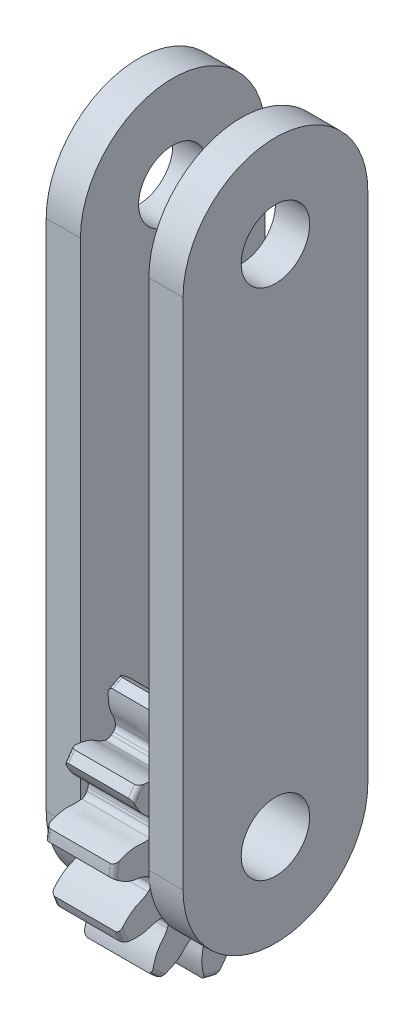
from build123d import *

# Parameters (mm, degrees)
SKETCH1_W                = 9
SKETCH1_H                = 7.5
CUT_EXTRUDE1_DEPTH       = 14.910427743
CUT_EXTRUDE2_DEPTH       = 14.910427916
CUT_EXTRUDE3_DEPTH       = 14.910427916
CUT_EXTRUDE4_DEPTH       = 14.910427916
CUT_EXTRUDE5_DEPTH       = 14.910427916
CUT_EXTRUDE6_DEPTH       = 14.910427916
CUT_EXTRUDE7_DEPTH       = 14.910427916
CUT_EXTRUDE8_DEPTH       = 14.910427916
CUT_EXTRUDE9_DEPTH       = 14.910427916
CUT_EXTRUDE10_DEPTH      = 14.910427916
CUT_EXTRUDE11_DEPTH      = 14.897973662
CUT_EXTRUDE12_DEPTH      = 14.897973662
CUT_EXTRUDE13_DEPTH      = 14.897973662
FILLET2_R                = 0.39
SKETCH15_W               = 7.292048081
SKETCH15_H               = 20.876726486
SKETCH15_W_2             = 7.106970719
CUT_EXTRUDE14_DEPTH      = 10
CUT_EXTRUDE15_DEPTH      = 10
CUT_EXTRUDE15_DEPTH_BACK = 11.881345073
SKETCH18_W               = 4.393422378
SKETCH18_H               = 18.360571133
FILLET4_R                = 0.25
SKETCH19_R               = 2
BOSS_EXTRUDE1_DEPTH      = 2
BOSS_EXTRUDE2_START      = -6
SKETCH19_2_R             = 2
BOSS_EXTRUDE2_DEPTH      = 2
SKETCH20_R               = 2
CUT_EXTRUDE16_DEPTH      = 5


with BuildPart() as part:
    # Sketch1 → Revolve1 (revolve)
    with BuildSketch(Plane.XY):
        with Locations((0, 3.75)):
            Rectangle(SKETCH1_W, SKETCH1_H)
    revolve(axis=Axis((-4.5, 0, 0), (1, 0, 0)))

    # Sketch2 → Cut-Extrude1 (cut, through all)
    with BuildSketch(Plane.ZY.offset(4.5)):
        with BuildLine():
            ThreePointArc((3.201594162, 6.782314857), (1.794867482, 7.282063631), (0.317028032, 7.493296553))
            add(Edge.make_bspline(
                [(0.317028032, 7.493296553), (0.371871945, 7.408970163), (0.423858847, 7.32269625), (0.47240366, 7.234592924), (0.55951672, 7.076492607), (0.636261204, 6.911885842), (0.697729626, 6.742162454), (0.77567653, 6.526939544), (0.83047634, 6.296563636), (0.826790854, 6.067690226), (0.823538507, 5.865715366), (0.858399887, 5.661440277), (0.918999535, 5.468743353), (0.941929817, 5.395828826), (0.966010575, 5.323281093), (0.989559235, 5.250563924)],
                knots=[-0.0003014, -0.0003014, -0.0003014, -0.0003014, 0, 0, 0, 0.000541534, 0.000541534, 0.000541534, 0.001234633, 0.001234633, 0.001234633, 0.001842085, 0.001842085, 0.001842085, 0.002069299, 0.002069299, 0.002069299, 0.002069299], degree=3))
            ThreePointArc((0.989559235, 5.250563924), (1.278663577, 5.187742135), (1.5638475, 5.109014582))
            add(Edge.make_bspline(
                [(1.5638475, 5.109014582), (1.618492169, 5.162458825), (1.673529252, 5.215505756), (1.727718082, 5.269412134), (1.888913184, 5.429767028), (2.014491806, 5.625477563), (2.123183008, 5.825186791), (2.250960235, 6.059964682), (2.453612602, 6.251567917), (2.66167207, 6.419374161), (2.752319565, 6.492484104), (2.846626475, 6.561254078), (2.943790305, 6.625450825), (3.027718259, 6.680902547), (3.113843861, 6.733134785), (3.201594162, 6.782314857)],
                knots=[-0.000226024, -0.000226024, -0.000226024, -0.000226024, 0, 0, 0, 0.000682113, 0.000682113, 0.000682113, 0.001501297, 0.001501297, 0.001501297, 0.001854279, 0.001854279, 0.001854279, 0.002159306, 0.002159306, 0.002159306, 0.002159306], degree=3))
        make_face()
    extrude(amount=-CUT_EXTRUDE1_DEPTH, mode=Mode.SUBTRACT)

    # Sketch3 → Cut-Extrude2 (cut, through all)
    with BuildSketch(Plane.ZY.offset(4.5)):
        with BuildLine():
            ThreePointArc((5.986769716, 4.517586564), (4.973419937, 5.613830611), (3.763022925, 6.487654312))
            add(Edge.make_bspline(
                [(3.763022925, 6.487654312), (3.77239637, 6.387499765), (3.778335, 6.28694849), (3.78037564, 6.186376971), (3.784037542, 6.005902635), (3.77549483, 5.824485643), (3.751048024, 5.645637246), (3.720047506, 5.418843091), (3.661509306, 5.189388614), (3.551883192, 4.988444004), (3.455140985, 4.811115588), (3.391077837, 4.614038089), (3.355185434, 4.415251375), (3.34160412, 4.340032535), (3.329211959, 4.264603822), (3.316269909, 4.189272358)],
                knots=[-0.0003014, -0.0003014, -0.0003014, -0.0003014, 0, 0, 0, 0.000541534, 0.000541534, 0.000541534, 0.001234633, 0.001234633, 0.001234633, 0.001842085, 0.001842085, 0.001842085, 0.002069299, 0.002069299, 0.002069299, 0.002069299], degree=3))
            ThreePointArc((3.316269909, 4.189272358), (3.543064349, 3.99929294), (3.758995654, 3.797051576))
            add(Edge.make_bspline(
                [(3.758995654, 3.797051576), (3.832217884, 3.818979459), (3.905602939, 3.840373176), (3.978636308, 3.862922098), (4.195888117, 3.929998207), (4.398033686, 4.044931983), (4.587084472, 4.171254402), (4.809332313, 4.319758862), (5.077814535, 4.39523785), (5.340025495, 4.447132845), (5.454265751, 4.469742492), (5.569729373, 4.486808674), (5.685597388, 4.498497788), (5.7856816, 4.508594583), (5.886215565, 4.51481937), (5.986769716, 4.517586564)],
                knots=[-0.000226024, -0.000226024, -0.000226024, -0.000226024, 0, 0, 0, 0.000682113, 0.000682113, 0.000682113, 0.001501297, 0.001501297, 0.001501297, 0.001854279, 0.001854279, 0.001854279, 0.002159306, 0.002159306, 0.002159306, 0.002159306], degree=3))
        make_face()
    extrude(amount=-CUT_EXTRUDE2_DEPTH, mode=Mode.SUBTRACT)

    # Sketch4 → Cut-Extrude3 (cut, through all)
    with BuildSketch(Plane.ZY.offset(4.5)):
        with BuildLine():
            ThreePointArc((7.400448478, 1.217933632), (7.01262182, 2.659536653), (6.346954614, 3.995768653))
            add(Edge.make_bspline(
                [(6.346954614, 3.995768653), (6.308710249, 3.902730148), (6.267240137, 3.810936598), (6.222309119, 3.720936607), (6.141680967, 3.559432748), (6.049808091, 3.402765975), (5.945046524, 3.255764582), (5.81220043, 3.06935499), (5.653734615, 2.893387198), (5.463281896, 2.766405379), (5.295212301, 2.654347209), (5.14690072, 2.50961538), (5.022738785, 2.350278517), (4.97575719, 2.289987093), (4.929731005, 2.228957209), (4.883263112, 2.168268981)],
                knots=[-0.0003014, -0.0003014, -0.0003014, -0.0003014, 0, 0, 0, 0.000541534, 0.000541534, 0.000541534, 0.001234633, 0.001234633, 0.001234633, 0.001842085, 0.001842085, 0.001842085, 0.002069299, 0.002069299, 0.002069299, 0.002069299], degree=3))
            ThreePointArc((4.883263112, 2.168268981), (4.995791778, 1.894653928), (5.093003205, 1.615229813))
            add(Edge.make_bspline(
                [(5.093003205, 1.615229813), (5.168028665, 1.600617923), (5.24295006, 1.585457383), (5.318096903, 1.571483163), (5.541635649, 1.529914158), (5.77403905, 1.537741233), (6.000140163, 1.561737899), (6.265944317, 1.589948346), (6.538750353, 1.532011761), (6.795043434, 1.456106987), (6.906705384, 1.423036742), (7.016874394, 1.384489475), (7.124902628, 1.34099312), (7.218215011, 1.303421936), (7.310126219, 1.262213248), (7.400448478, 1.217933632)],
                knots=[-0.000226024, -0.000226024, -0.000226024, -0.000226024, 0, 0, 0, 0.000682113, 0.000682113, 0.000682113, 0.001501297, 0.001501297, 0.001501297, 0.001854279, 0.001854279, 0.001854279, 0.002159306, 0.002159306, 0.002159306, 0.002159306], degree=3))
        make_face()
    extrude(amount=-CUT_EXTRUDE3_DEPTH, mode=Mode.SUBTRACT)

    # Sketch5 → Cut-Extrude4 (cut, through all)
    with BuildSketch(Plane.ZY.offset(4.5)):
        with BuildLine():
            ThreePointArc((7.118773678, -2.360733218), (7.445316556, -0.904025102), (7.476875491, 0.58850055))
            add(Edge.make_bspline(
                [(7.476875491, 0.58850055), (7.399774639, 0.523892088), (7.320396088, 0.461885057), (7.238786565, 0.403074509), (7.092339297, 0.297539714), (6.938183226, 0.20151363), (6.777106511, 0.120035489), (6.57284828, 0.01671465), (6.350757459, -0.065454355), (6.123108558, -0.089383381), (5.922214294, -0.110500127), (5.723630676, -0.169729969), (5.53964321, -0.253114825), (5.470024252, -0.284666794), (5.400908088, -0.317316639), (5.331559587, -0.349458689)],
                knots=[-0.0003014, -0.0003014, -0.0003014, -0.0003014, 0, 0, 0, 0.000541534, 0.000541534, 0.000541534, 0.001234633, 0.001234633, 0.001234633, 0.001842085, 0.001842085, 0.001842085, 0.002069299, 0.002069299, 0.002069299, 0.002069299], degree=3))
            ThreePointArc((5.331559587, -0.349458689), (5.304043517, -0.644027465), (5.260265099, -0.936621634))
            add(Edge.make_bspline(
                [(5.260265099, -0.936621634), (5.31990636, -0.98442589), (5.379200507, -1.03266759), (5.439245589, -1.079963626), (5.617861238, -1.220654788), (5.827281653, -1.321727502), (6.038636052, -1.405553936), (6.287103991, -1.504100175), (6.501737266, -1.68217976), (6.693398811, -1.868495433), (6.776902048, -1.949669576), (6.856538054, -2.034999578), (6.93197854, -2.123716912), (6.997142353, -2.20034897), (7.059375053, -2.279550719), (7.118773678, -2.360733218)],
                knots=[-0.000226024, -0.000226024, -0.000226024, -0.000226024, 0, 0, 0, 0.000682113, 0.000682113, 0.000682113, 0.001501297, 0.001501297, 0.001501297, 0.001854279, 0.001854279, 0.001854279, 0.002159348, 0.002159348, 0.002159348, 0.002159348], degree=3))
        make_face()
    extrude(amount=-CUT_EXTRUDE4_DEPTH, mode=Mode.SUBTRACT)

    # Sketch6 → Cut-Extrude5 (cut, through all)
    with BuildSketch(Plane.ZY.offset(4.5)):
        with BuildLine():
            ThreePointArc((5.206273619, -5.398584537), (6.172378994, -4.2604856), (6.893934298, -2.953585937))
            add(Edge.make_bspline(
                [(6.893934298, -2.953585937), (6.795639835, -2.974963337), (6.696537515, -2.992978783), (6.596945247, -3.007127102), (6.418228166, -3.032516083), (6.237104198, -3.045903059), (6.05661307, -3.043192289), (5.827735801, -3.039754814), (5.592898304, -3.009301104), (5.38020484, -2.924695485), (5.192508363, -2.850033215), (4.989145821, -2.810192227), (4.787482136, -2.798522612), (4.711174679, -2.79410695), (4.634802216, -2.790897068), (4.558460012, -2.787129585)],
                knots=[-0.000301441, -0.000301441, -0.000301441, -0.000301441, 0, 0, 0, 0.000541534, 0.000541534, 0.000541534, 0.001234633, 0.001234633, 0.001234633, 0.001842085, 0.001842085, 0.001842085, 0.002069299, 0.002069299, 0.002069299, 0.002069299], degree=3))
            ThreePointArc((4.558460012, -2.787129585), (4.397202806, -3.035169927), (4.222463652, -3.273904352))
            add(Edge.make_bspline(
                [(4.222463652, -3.273904352), (4.253057621, -3.343949595), (4.283140944, -3.414220862), (4.314328659, -3.484003764), (4.407102519, -3.691586432), (4.545564255, -3.878404395), (4.693753195, -4.050850303), (4.867963908, -4.253577473), (4.975254525, -4.511004171), (5.058377185, -4.765048067), (5.094592124, -4.875730091), (5.125451476, -4.988294752), (5.151021708, -5.101908992), (5.173108706, -5.200046443), (5.191406137, -5.299097087), (5.206273619, -5.398584537)],
                knots=[-0.000226024, -0.000226024, -0.000226024, -0.000226024, 0, 0, 0, 0.000682113, 0.000682113, 0.000682113, 0.001501297, 0.001501297, 0.001501297, 0.001854279, 0.001854279, 0.001854279, 0.002159306, 0.002159306, 0.002159306, 0.002159306], degree=3))
        make_face()
    extrude(amount=-CUT_EXTRUDE5_DEPTH, mode=Mode.SUBTRACT)

    # Sketch7 → Cut-Extrude6 (cut, through all)
    with BuildSketch(Plane.ZY.offset(4.5)):
        with BuildLine():
            ThreePointArc((2.741072183, -4.586302681), (2.483015924, -4.730991537), (2.217346668, -4.861175038))
            add(Edge.make_bspline(
                [(2.217346668, -4.861175038), (2.211884635, -4.937414746), (2.205865408, -5.013617281), (2.201051028, -5.089900626), (2.186729725, -5.316820112), (2.222512867, -5.546585581), (2.273588047, -5.768145684), (2.333631959, -6.028611433), (2.309000931, -6.306411889), (2.264542306, -6.569985614), (2.245172541, -6.684819601), (2.220185733, -6.798831714), (2.19002788, -6.911315207), (2.163978197, -7.008475944), (2.134148639, -7.104684174), (2.101079016, -7.199685199)],
                knots=[-0.000226024, -0.000226024, -0.000226024, -0.000226024, 0, 0, 0, 0.000682113, 0.000682113, 0.000682113, 0.001501297, 0.001501297, 0.001501297, 0.001854279, 0.001854279, 0.001854279, 0.002159306, 0.002159306, 0.002159306, 0.002159306], degree=3))
            ThreePointArc((2.101079016, -7.199685199), (3.48542379, -6.640920192), (4.731675839, -5.81904148))
            add(Edge.make_bspline(
                [(4.731675839, -5.81904148), (4.634705841, -5.792290513), (4.5385829, -5.762187254), (4.443823274, -5.728432133), (4.27377831, -5.66785899), (4.107179763, -5.595540064), (3.948622564, -5.509261387), (3.747559281, -5.399853084), (3.55377355, -5.263753237), (3.404761032, -5.0899951), (3.273261342, -4.936658041), (3.111707784, -4.806873313), (2.9385666, -4.702822594), (2.873051763, -4.663450876), (2.806919011, -4.625116614), (2.741072183, -4.586302681)],
                knots=[-0.0003014, -0.0003014, -0.0003014, -0.0003014, 0, 0, 0, 0.000541534, 0.000541534, 0.000541534, 0.001234633, 0.001234633, 0.001234633, 0.001842085, 0.001842085, 0.001842085, 0.002069299, 0.002069299, 0.002069299, 0.002069299], degree=3))
        make_face()
    extrude(amount=-CUT_EXTRUDE6_DEPTH, mode=Mode.SUBTRACT)

    # Sketch8 → Cut-Extrude7 (cut, through all)
    with BuildSketch(Plane.ZY.offset(4.5)):
        with BuildLine():
            ThreePointArc((-1.485447468, -7.351424748), (0, -7.5), (1.485447468, -7.351424748))
            add(Edge.make_bspline(
                [(1.485447468, -7.351424748), (1.412016594, -7.282673737), (1.340893638, -7.211348067), (1.272674943, -7.137422398), (1.150257348, -7.004763709), (1.036349942, -6.863306274), (0.936050215, -6.713225095), (0.808862093, -6.522910087), (0.700522102, -6.312342938), (0.649327503, -6.089238178), (0.604149594, -5.892354003), (0.521414994, -5.702357651), (0.416460869, -5.529762594), (0.376747312, -5.464454407), (0.336004488, -5.399777681), (0.295737752, -5.334809105)],
                knots=[-0.0003014, -0.0003014, -0.0003014, -0.0003014, 0, 0, 0, 0.000541534, 0.000541534, 0.000541534, 0.001234633, 0.001234633, 0.001234633, 0.001842085, 0.001842085, 0.001842085, 0.002069299, 0.002069299, 0.002069299, 0.002069299], degree=3))
            ThreePointArc((0.295737752, -5.334809105), (1.8e-08, -5.343), (-0.295737715, -5.334809107))
            add(Edge.make_bspline(
                [(-0.295737715, -5.334809107), (-0.336004465, -5.399777682), (-0.376747309, -5.464454402), (-0.416460869, -5.529762594), (-0.534596496, -5.72403438), (-0.609689435, -5.944110854), (-0.667428722, -6.164028402), (-0.735306948, -6.422563166), (-0.88621695, -6.657096644), (-1.048071925, -6.869818634), (-1.118589015, -6.962497501), (-1.193697805, -7.051838265), (-1.272674943, -7.137422398), (-1.340893638, -7.211348067), (-1.412016594, -7.282673737), (-1.485447468, -7.351424748)],
                knots=[-0.000226024, -0.000226024, -0.000226024, -0.000226024, 0, 0, 0, 0.000682113, 0.000682113, 0.000682113, 0.001501297, 0.001501297, 0.001501297, 0.001854279, 0.001854279, 0.001854279, 0.002159306, 0.002159306, 0.002159306, 0.002159306], degree=3))
        make_face()
    extrude(amount=-CUT_EXTRUDE7_DEPTH, mode=Mode.SUBTRACT)

    # Sketch9 → Cut-Extrude8 (cut, through all)
    with BuildSketch(Plane.ZY.offset(4.5)):
        with BuildLine():
            ThreePointArc((-4.731675839, -5.81904148), (-3.48542379, -6.640920192), (-2.101079016, -7.199685199))
            add(Edge.make_bspline(
                [(-2.101079016, -7.199685199), (-2.134148639, -7.104684174), (-2.163978197, -7.008475944), (-2.19002788, -6.911315207), (-2.23677371, -6.736961478), (-2.271895162, -6.558771729), (-2.290959958, -6.379269837), (-2.315135652, -6.151646999), (-2.313210517, -5.914850944), (-2.254859131, -5.693510173), (-2.203365544, -5.498182673), (-2.188327687, -5.291500573), (-2.201051028, -5.089900626), (-2.205865408, -5.013617287), (-2.211884614, -4.937414757), (-2.217346635, -4.861175053)],
                knots=[-0.0003014, -0.0003014, -0.0003014, -0.0003014, 0, 0, 0, 0.000541534, 0.000541534, 0.000541534, 0.001234633, 0.001234633, 0.001234633, 0.001842085, 0.001842085, 0.001842085, 0.002069299, 0.002069299, 0.002069299, 0.002069299], degree=3))
            ThreePointArc((-2.217346635, -4.861175053), (-2.483015892, -4.730991554), (-2.741072152, -4.5863027))
            add(Edge.make_bspline(
                [(-2.741072152, -4.5863027), (-2.806918991, -4.625116625), (-2.873051758, -4.663450873), (-2.9385666, -4.702822594), (-3.133453103, -4.819941353), (-3.302219236, -4.979911964), (-3.455545616, -5.147806498), (-3.635795895, -5.345183078), (-3.878413208, -5.482720785), (-4.120585508, -5.595858995), (-4.226095307, -5.64515113), (-4.334119561, -5.689353654), (-4.443823274, -5.728432133), (-4.5385829, -5.762187254), (-4.634705841, -5.792290513), (-4.731675839, -5.81904148)],
                knots=[-0.000226024, -0.000226024, -0.000226024, -0.000226024, 0, 0, 0, 0.000682113, 0.000682113, 0.000682113, 0.001501297, 0.001501297, 0.001501297, 0.001854279, 0.001854279, 0.001854279, 0.002159306, 0.002159306, 0.002159306, 0.002159306], degree=3))
        make_face()
    extrude(amount=-CUT_EXTRUDE8_DEPTH, mode=Mode.SUBTRACT)

    # Sketch10 → Cut-Extrude9 (cut, through all)
    with BuildSketch(Plane.ZY.offset(4.5)):
        with BuildLine():
            ThreePointArc((-6.893934298, -2.953585937), (-6.172378994, -4.2604856), (-5.206273619, -5.398584537))
            add(Edge.make_bspline(
                [(-5.206273619, -5.398584537), (-5.191406137, -5.299097087), (-5.173108706, -5.200046443), (-5.151021708, -5.101908992), (-5.111386867, -4.925802561), (-5.059676463, -4.751701622), (-4.993138813, -4.583900738), (-4.90876372, -4.371115719), (-4.797014483, -4.16233788), (-4.642484713, -3.993467602), (-4.50611619, -3.844443953), (-4.396750868, -3.668424483), (-4.314328659, -3.484003764), (-4.283140946, -3.414220868), (-4.253057607, -3.343949614), (-4.22246363, -3.273904381)],
                knots=[-0.0003014, -0.0003014, -0.0003014, -0.0003014, 0, 0, 0, 0.000541534, 0.000541534, 0.000541534, 0.001234633, 0.001234633, 0.001234633, 0.001842085, 0.001842085, 0.001842085, 0.002069299, 0.002069299, 0.002069299, 0.002069299], degree=3))
            ThreePointArc((-4.22246363, -3.273904381), (-4.397202785, -3.035169957), (-4.558459993, -2.787129616))
            add(Edge.make_bspline(
                [(-4.558459993, -2.787129616), (-4.634802203, -2.790897088), (-4.711174673, -2.794106949), (-4.787482136, -2.798522612), (-5.014473366, -2.811657849), (-5.238250405, -2.874875258), (-5.452038652, -2.952284163), (-5.703367818, -3.043285963), (-5.982111739, -3.052319668), (-6.24912261, -3.039955498), (-6.365454095, -3.034568668), (-6.481646758, -3.023506684), (-6.596945247, -3.007127102), (-6.696537515, -2.992978783), (-6.795639835, -2.974963337), (-6.893934298, -2.953585937)],
                knots=[-0.000226024, -0.000226024, -0.000226024, -0.000226024, 0, 0, 0, 0.000682113, 0.000682113, 0.000682113, 0.001501297, 0.001501297, 0.001501297, 0.001854279, 0.001854279, 0.001854279, 0.002159348, 0.002159348, 0.002159348, 0.002159348], degree=3))
        make_face()
    extrude(amount=-CUT_EXTRUDE9_DEPTH, mode=Mode.SUBTRACT)

    # Sketch11 → Cut-Extrude10 (cut, through all)
    with BuildSketch(Plane.ZY.offset(4.5)):
        with BuildLine():
            ThreePointArc((-7.476875491, 0.58850055), (-7.445316556, -0.904025102), (-7.118773678, -2.360733218))
            add(Edge.make_bspline(
                [(-7.118773678, -2.360733218), (-7.059375053, -2.279550719), (-6.997142353, -2.20034897), (-6.93197854, -2.123716912), (-6.815042892, -1.986201641), (-6.688346863, -1.856073938), (-6.55144974, -1.738415222), (-6.377853177, -1.589214505), (-6.181880242, -1.45628337), (-5.966572994, -1.37856973), (-5.776569921, -1.309989454), (-5.597931411, -1.204956553), (-5.439245589, -1.079963626), (-5.379200511, -1.032667593), (-5.319906357, -0.984425913), (-5.260265093, -0.93662167)],
                knots=[-0.0003014, -0.0003014, -0.0003014, -0.0003014, 0, 0, 0, 0.000541534, 0.000541534, 0.000541534, 0.001234633, 0.001234633, 0.001234633, 0.001842085, 0.001842085, 0.001842085, 0.002069299, 0.002069299, 0.002069299, 0.002069299], degree=3))
            ThreePointArc((-5.260265093, -0.93662167), (-5.304043512, -0.644027501), (-5.331559584, -0.349458725))
            add(Edge.make_bspline(
                [(-5.331559584, -0.349458725), (-5.400908086, -0.317316662), (-5.470024247, -0.284666796), (-5.53964321, -0.253114825), (-5.746738212, -0.159257416), (-5.974261534, -0.111239276), (-6.199535337, -0.080429105), (-6.464366908, -0.04420871), (-6.715380564, 0.077331101), (-6.946061032, 0.212365169), (-7.046564061, 0.271196906), (-7.144306795, 0.334989229), (-7.238786565, 0.403074509), (-7.320396088, 0.461885057), (-7.399774639, 0.523892088), (-7.476875491, 0.58850055)],
                knots=[-0.000226024, -0.000226024, -0.000226024, -0.000226024, 0, 0, 0, 0.000682113, 0.000682113, 0.000682113, 0.001501297, 0.001501297, 0.001501297, 0.001854279, 0.001854279, 0.001854279, 0.002159306, 0.002159306, 0.002159306, 0.002159306], degree=3))
        make_face()
    extrude(amount=-CUT_EXTRUDE10_DEPTH, mode=Mode.SUBTRACT)

    # Sketch12 → Cut-Extrude11 (cut, through all)
    with BuildSketch(Plane.ZY.offset(4.5)):
        with BuildLine():
            ThreePointArc((-6.346954614, 3.995768653), (-7.01262182, 2.659536653), (-7.400448478, 1.217933632))
            add(Edge.make_bspline(
                [(-7.400448478, 1.217933632), (-7.310126219, 1.262213248), (-7.218215011, 1.303421936), (-7.124902628, 1.340993119), (-6.957454721, 1.40841414), (-6.784797599, 1.464757917), (-6.608902486, 1.505320271), (-6.385853332, 1.556756599), (-6.150551737, 1.58338811), (-5.923791308, 1.552141854), (-5.723681099, 1.524567842), (-5.516693331, 1.534552402), (-5.318096903, 1.571483163), (-5.242950066, 1.585457382), (-5.168028672, 1.600617901), (-5.093003216, 1.615229779)],
                knots=[-0.0003014, -0.0003014, -0.0003014, -0.0003014, 0, 0, 0, 0.000541534, 0.000541534, 0.000541534, 0.001234633, 0.001234633, 0.001234633, 0.001842085, 0.001842085, 0.001842085, 0.002069299, 0.002069299, 0.002069299, 0.002069299], degree=3))
            ThreePointArc((-5.093003216, 1.615229779), (-4.995791791, 1.894653894), (-4.883263127, 2.168268948))
            add(Edge.make_bspline(
                [(-4.883263127, 2.168268948), (-4.929731014, 2.228957187), (-4.975757186, 2.289987089), (-5.022738785, 2.350278517), (-5.162494589, 2.529626972), (-5.341641343, 2.677880283), (-5.526793189, 2.809851291), (-5.744457443, 2.964996226), (-5.91023663, 3.189266247), (-6.051740581, 3.416035534), (-6.113391122, 3.514834537), (-6.170292244, 3.616743148), (-6.222309119, 3.720936607), (-6.267240137, 3.810936598), (-6.308710249, 3.902730148), (-6.346954614, 3.995768653)],
                knots=[-0.000226024, -0.000226024, -0.000226024, -0.000226024, 0, 0, 0, 0.000682113, 0.000682113, 0.000682113, 0.001501297, 0.001501297, 0.001501297, 0.001854279, 0.001854279, 0.001854279, 0.002159306, 0.002159306, 0.002159306, 0.002159306], degree=3))
        make_face()
    extrude(amount=-CUT_EXTRUDE11_DEPTH, mode=Mode.SUBTRACT)

    # Sketch13 → Cut-Extrude12 (cut, through all)
    with BuildSketch(Plane.ZY.offset(4.5)):
        with BuildLine():
            ThreePointArc((-3.763022925, 6.487654312), (-4.973419937, 5.613830611), (-5.986769716, 4.517586564))
            add(Edge.make_bspline(
                [(-5.986769716, 4.517586564), (-5.886215565, 4.51481937), (-5.7856816, 4.508594583), (-5.685597388, 4.498497788), (-5.505997519, 4.480379214), (-5.326932971, 4.450031386), (-5.152335318, 4.404205032), (-4.930931447, 4.346093528), (-4.710205951, 4.260324456), (-4.523940423, 4.127276445), (-4.359565915, 4.009865018), (-4.171647291, 3.922513895), (-3.978636308, 3.862922098), (-3.905602944, 3.840373177), (-3.832217901, 3.818979443), (-3.75899568, 3.79705155)],
                knots=[-0.0003014, -0.0003014, -0.0003014, -0.0003014, 0, 0, 0, 0.000541534, 0.000541534, 0.000541534, 0.001234633, 0.001234633, 0.001234633, 0.001842085, 0.001842085, 0.001842085, 0.002069299, 0.002069299, 0.002069299, 0.002069299], degree=3))
            ThreePointArc((-3.75899568, 3.79705155), (-3.543064377, 3.999292915), (-3.316269938, 4.189272336))
            add(Edge.make_bspline(
                [(-3.316269938, 4.189272336), (-3.329211977, 4.264603807), (-3.341604119, 4.340032529), (-3.355185434, 4.415251375), (-3.395585671, 4.639004306), (-3.485315495, 4.853529742), (-3.587929327, 5.056428619), (-3.708562005, 5.294956259), (-3.751128711, 5.57057893), (-3.771039294, 5.837133327), (-3.77971395, 5.953265934), (-3.782738099, 6.069944797), (-3.78037564, 6.186376971), (-3.778335, 6.28694849), (-3.77239637, 6.387499765), (-3.763022925, 6.487654312)],
                knots=[-0.000226024, -0.000226024, -0.000226024, -0.000226024, 0, 0, 0, 0.000682113, 0.000682113, 0.000682113, 0.001501297, 0.001501297, 0.001501297, 0.001854279, 0.001854279, 0.001854279, 0.002159306, 0.002159306, 0.002159306, 0.002159306], degree=3))
        make_face()
    extrude(amount=-CUT_EXTRUDE12_DEPTH, mode=Mode.SUBTRACT)

    # Sketch14 → Cut-Extrude13 (cut, through all)
    with BuildSketch(Plane.ZY.offset(4.5)):
        with BuildLine():
            ThreePointArc((-0.317028032, 7.493296553), (-1.794867482, 7.282063631), (-3.201594162, 6.782314857))
            add(Edge.make_bspline(
                [(-3.201594162, 6.782314857), (-3.113843861, 6.733134785), (-3.027718259, 6.680902547), (-2.943790305, 6.625450825), (-2.79318264, 6.525943404), (-2.648732196, 6.415856293), (-2.51543022, 6.294139496), (-2.346392591, 6.139792806), (-2.190808746, 5.961271812), (-2.087709306, 5.756901741), (-1.996726718, 5.576550443), (-1.870927131, 5.411874726), (-1.727718082, 5.269412134), (-1.673529256, 5.21550576), (-1.618492191, 5.162458818), (-1.563847535, 5.109014571)],
                knots=[-0.0003014, -0.0003014, -0.0003014, -0.0003014, 0, 0, 0, 0.000541534, 0.000541534, 0.000541534, 0.001234633, 0.001234633, 0.001234633, 0.001842085, 0.001842085, 0.001842085, 0.002069299, 0.002069299, 0.002069299, 0.002069299], degree=3))
            ThreePointArc((-1.563847535, 5.109014571), (-1.278663612, 5.187742126), (-0.989559271, 5.250563917))
            add(Edge.make_bspline(
                [(-0.989559271, 5.250563917), (-0.966010597, 5.323281088), (-0.941929819, 5.39582882), (-0.918999535, 5.468743353), (-0.850788996, 5.68564166), (-0.830545869, 5.917294028), (-0.827114095, 6.144639087), (-0.823079706, 6.411905624), (-0.732682409, 6.675739113), (-0.62643835, 6.921014219), (-0.580149864, 7.02787585), (-0.528604243, 7.132595244), (-0.47240366, 7.234592924), (-0.423858847, 7.32269625), (-0.371871945, 7.408970163), (-0.317028032, 7.493296553)],
                knots=[-0.000226024, -0.000226024, -0.000226024, -0.000226024, 0, 0, 0, 0.000682113, 0.000682113, 0.000682113, 0.001501297, 0.001501297, 0.001501297, 0.001854279, 0.001854279, 0.001854279, 0.002159306, 0.002159306, 0.002159306, 0.002159306], degree=3))
        make_face()
    extrude(amount=-CUT_EXTRUDE13_DEPTH, mode=Mode.SUBTRACT)

    # Fillet2
    fillet2_edges = [part.edges().sort_by_distance(p)[0] for p in [
        (0, -4.861175053, -2.217346635),
        (0, 4.189272336, -3.316269938),
        (0, -0.349458725, -5.331559584),
        (0, 5.250563924, 0.989559235),
        (0, -5.334809105, 0.295737752),
        (0, 5.109014582, 1.5638475),
        (0, -2.787129616, -4.558459993),
        (0, 4.189272358, 3.316269909),
        (0, 2.168268948, -4.883263127),
        (0, 3.797051576, 3.758995654),
        (0, 5.250563917, -0.989559271),
        (0, 2.168268981, 4.883263112),
        (0, -5.334809107, -0.295737715),
        (0, 1.615229813, 5.093003205),
        (0, -4.5863027, -2.741072152),
        (0, -0.349458689, 5.331559587),
        (0, -0.93662167, -5.260265093),
        (0, -0.936621634, 5.260265099),
        (0, 1.615229779, -5.093003216),
        (0, -2.787129585, 4.558460012),
        (0, 3.79705155, -3.75899568),
        (0, -3.273904352, 4.222463652),
        (0, 5.109014571, -1.563847535),
        (0, -4.586302681, 2.741072183),
        (0, -4.861175038, 2.217346668),
        (0, -3.273904381, -4.22246363),
    ]]
    fillet(fillet2_edges, radius=FILLET2_R)

    # Sketch15 → Cut-Extrude14 (cut, symmetric)
    with BuildSketch(Plane(origin=(0, 0, 0), x_dir=(1, 0, 0), z_dir=(0, 1, 0))):
        with Locations((-6.146024041, 0.536724351)):
            Rectangle(SKETCH15_W, SKETCH15_H)
        with Locations((6.05348536, 0.536724351)):
            Rectangle(SKETCH15_W_2, SKETCH15_H)
    extrude(amount=CUT_EXTRUDE14_DEPTH, both=True, mode=Mode.SUBTRACT)

    # Sketch18 → Cut-Extrude15 (cut, two sides: drawn at the far end of the back side and taken through both)
    with BuildSketch(Plane.XY.offset(-CUT_EXTRUDE15_DEPTH_BACK)):
        with Locations((3.696711189, 0.333229775)):
            Rectangle(SKETCH18_W, SKETCH18_H)
    extrude(amount=CUT_EXTRUDE15_DEPTH + CUT_EXTRUDE15_DEPTH_BACK, mode=Mode.SUBTRACT)

    # Fillet4
    fillet4_edges = [part.edges().sort_by_distance(p)[0] for p in [
        (-2.5, 4.2604856, 6.172378994),
        (1.5, 4.2604856, 6.172378994),
        (1.5, 0.904025102, 7.445316556),
        (-2.5, 0.904025102, 7.445316556),
        (-2.5, -2.659536653, 7.01262182),
        (1.5, -2.659536653, 7.01262182),
        (1.5, -5.613830611, 4.973419937),
        (-2.5, -5.613830611, 4.973419937),
        (-2.5, -7.282063631, 1.794867482),
        (1.5, -7.282063631, 1.794867482),
        (1.5, -7.282063631, -1.794867482),
        (-2.5, -7.282063631, -1.794867482),
        (1.5, -5.613830611, -4.973419937),
        (-2.5, -5.613830611, -4.973419937),
        (1.5, -2.659536653, -7.01262182),
        (-2.5, -2.659536653, -7.01262182),
        (-2.5, 0.904025102, -7.445316556),
        (1.5, 0.904025102, -7.445316556),
        (1.5, 4.2604856, -6.172378994),
        (-2.5, 4.2604856, -6.172378994),
        (-2.5, 6.640920192, -3.48542379),
        (1.5, 6.640920192, -3.48542379),
        (1.5, 7.5, 0),
        (-2.5, 7.5, 0),
        (1.5, 6.640920192, 3.48542379),
        (-2.5, 6.640920192, 3.48542379),
    ]]
    fillet(fillet4_edges, radius=FILLET4_R)

    # Sketch19 → Boss-Extrude1 (add)
    with BuildSketch(Plane.ZY.offset(2.5)):
        with BuildLine():
            Line((5.4, 0), (5.4, 30))
            ThreePointArc((5.4, 30), (0, 35.4), (-5.4, 30))
            Line((-5.4, 30), (-5.4, 0))
            ThreePointArc((-5.4, 0), (0, -5.4), (5.4, 0))
        make_face()
        with Locations((0, 30)):
            Circle(SKETCH19_R, mode=Mode.SUBTRACT)
    extrude(amount=BOSS_EXTRUDE1_DEPTH)

    # Sketch19<2> → Boss-Extrude2 (add)
    with BuildSketch(Plane.ZY.offset(2.5).offset(BOSS_EXTRUDE2_START)):
        with BuildLine():
            Line((5.4, 0), (5.4, 30))
            ThreePointArc((5.4, 30), (0, 35.4), (-5.4, 30))
            Line((-5.4, 30), (-5.4, 0))
            ThreePointArc((-5.4, 0), (0, -5.4), (5.4, 0))
        make_face()
        with Locations((0, 30)):
            Circle(SKETCH19_2_R, mode=Mode.SUBTRACT)
    extrude(amount=BOSS_EXTRUDE2_DEPTH)

    # Sketch20 → Cut-Extrude16 (cut, symmetric)
    with BuildSketch(Plane(origin=(0, 0, 0), x_dir=(0, 0, -1), z_dir=(1, 0, 0))):
        Circle(SKETCH20_R)
    extrude(amount=CUT_EXTRUDE16_DEPTH, both=True, mode=Mode.SUBTRACT)


solid = part.part
